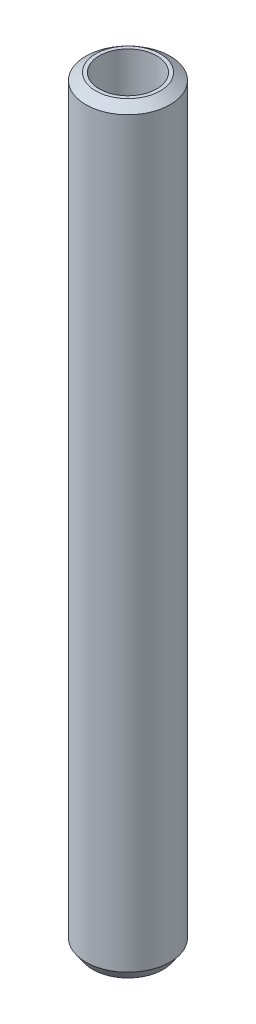
from build123d import *
from OCP.BRepFilletAPI import BRepFilletAPI_MakeChamfer

# Parameters (mm, degrees)
SKETCH1_R           = 30
BOSS_EXTRUDE1_DEPTH = 540.845389075
SKETCH2_R           = 20.452085101
CUT_EXTRUDE1_DEPTH  = 543.506898466
CHAMFER1_SIZE       = 4.957399601
CHAMFER1_SIZE2      = 7.059979121


with BuildPart() as part:
    # Sketch1 → Boss-Extrude1 (new body)
    with BuildSketch(Plane(origin=(0, 0, 0), x_dir=(1, 0, 0), z_dir=(0, 1, 0))):
        Circle(SKETCH1_R)
    extrude(amount=BOSS_EXTRUDE1_DEPTH)

    # Sketch2 → Cut-Extrude1 (cut, through all)
    with BuildSketch(Plane(origin=(0, 0, 0), x_dir=(1, 0, 0), z_dir=(0, 1, 0))):
        Circle(SKETCH2_R)
    extrude(amount=CUT_EXTRUDE1_DEPTH, mode=Mode.SUBTRACT)

    # Chamfer1: one chamfer whose edges measure the first distance from different faces: ONE call of the kernel's chamfer builder (chamfer() names one face for all edges)
    chamfer1_edges_1 = [part.edges().sort_by_distance(p)[0] for p in [
        (-30, 540.845389075, 0),
    ]]
    chamfer1_side_1 = [part.faces().sort_by_distance(p)[0] for p in [
        (-30, 270.422694537, 0),
    ]]
    chamfer1_edges_2 = [part.edges().sort_by_distance(p)[0] for p in [
        (-30, 0, 0),
    ]]
    chamfer1_side_2 = [part.faces().sort_by_distance(p)[0] for p in [
        (-29.151471863, 0, 0),
    ]]
    chamfer1 = BRepFilletAPI_MakeChamfer(part.part.solid().wrapped)
    for e in chamfer1_edges_1:
        chamfer1.Add(CHAMFER1_SIZE, CHAMFER1_SIZE2, e.wrapped, chamfer1_side_1[0].wrapped)  # the first distance lies on this face
    for e in chamfer1_edges_2:
        chamfer1.Add(CHAMFER1_SIZE, CHAMFER1_SIZE2, e.wrapped, chamfer1_side_2[0].wrapped)  # the first distance lies on this face
    add(Compound.cast(chamfer1.Shape()), mode=Mode.REPLACE)


solid = part.part
